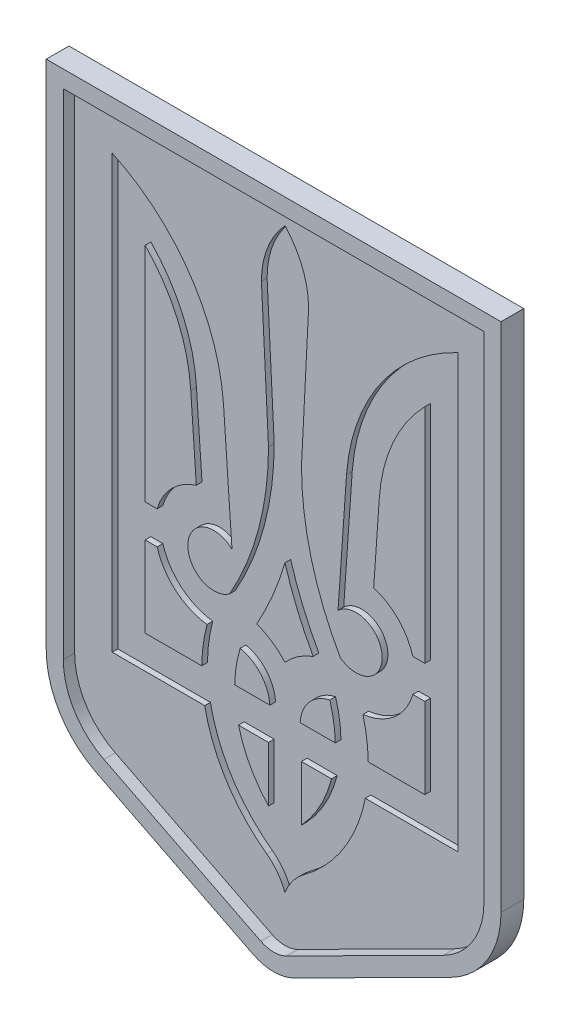
from build123d import *

# Parameters (mm, degrees)
EXTRUDE_1_DEPTH     = 2
EXTRUDE_2_DEPTH     = 2
OTHER_START         = 1
OTHER_1_DEPTH       = 1
CUT_EXTRUDE_1_DEPTH = 10


# Read off the part's stored shape, not the designer's step: Полость1
with BuildPart() as part:
    # Эскиз1 → Бобышка-Вытянуть1 (new body)
    with BuildSketch(Plane.XY):
        with BuildLine():
            Line((-3.59812982, 1.811928513), (-31.19625964, 15.709658955))
            ThreePointArc((-31.19625964, 15.709658955), (-37.622410841, 21.607746257), (-40, 30))
            Line((-40, 30), (-40, 120))
            Line((-40, 120), (40, 120))
            Line((40, 120), (40, 30))
            ThreePointArc((40, 30), (37.622410841, 21.607746257), (31.19625964, 15.709658955))
            Line((31.19625964, 15.709658955), (3.59812982, 1.811928513))
            ThreePointArc((3.59812982, 1.811928513), (0, 0.957099036), (-3.59812982, 1.811928513))
        make_face()
    extrude(amount=EXTRUDE_1_DEPTH)

    # Эскиз2 → Бобышка-Вытянуть2 (add)
    with BuildSketch(Plane.XY.offset(2)):
        with BuildLine():
            Line((40, 120), (-40, 120))
            Line((-40, 120), (-40, 30))
            ThreePointArc((-40, 30), (-37.622410841, 21.607746257), (-31.19625964, 15.709658955))
            Line((-31.19625964, 15.709658955), (-3.59812982, 1.811928513))
            ThreePointArc((-3.59812982, 1.811928513), (0, 0.957099036), (3.59812982, 1.811928513))
            Line((3.59812982, 1.811928513), (31.19625964, 15.709658955))
            ThreePointArc((31.19625964, 15.709658955), (37.622410841, 21.607746257), (40, 30))
            Line((40, 30), (40, 120))
        make_face()
        with BuildLine():
            Line((37, 117), (-37, 117))
            Line((-37, 117), (-37, 30))
            ThreePointArc((-37, 30), (-35.068208808, 23.181293834), (-29.846960958, 18.389097901))
            Line((-29.846960958, 18.389097901), (-2.248831138, 4.491367459))
            ThreePointArc((-2.248831138, 4.491367459), (0, 3.957099036), (2.248831138, 4.491367459))
            Line((2.248831138, 4.491367459), (29.846960958, 18.389097901))
            ThreePointArc((29.846960958, 18.389097901), (35.068208808, 23.181293834), (37, 30))
            Line((37, 30), (37, 117))
        make_face(mode=Mode.SUBTRACT)
    extrude(amount=EXTRUDE_2_DEPTH)

    # Полость1 outline → Полость1 (cut)
    with BuildSketch(Plane.XY.offset(OTHER_START)):
        with BuildLine():
            ThreePointArc((9.788029472, 60.549586915), (17.495233568, 56.130696454), (9.431968209, 52.400905625))
            ThreePointArc((9.431968209, 52.400905625), (4.262579544, 64.984556644), (2.5, 78.473966026))
            Line((2.5, 78.473966026), (3.75, 103.098966026))
            ThreePointArc((3.75, 103.098966026), (2.7812152, 108.402266884), (0, 113.020533442))
            ThreePointArc((0, 113.020533442), (-2.7812152, 108.402266884), (-3.75, 103.098966026))
            Line((-3.75, 103.098966026), (-2.5, 78.473966026))
            ThreePointArc((-2.5, 78.473966026), (-4.262579544, 64.984556644), (-9.431968209, 52.400905625))
            ThreePointArc((-9.431968209, 52.400905625), (-17.495233567, 56.130696454), (-9.788029472, 60.549586915))
            Line((-9.788029472, 60.549586915), (-11.224736233, 81.095450805))
            ThreePointArc((-11.224736233, 81.095450805), (-16.940759264, 97.456053222), (-30, 108.848966026))
            Line((-30, 108.848966026), (-30, 33.848966026))
            Line((-30, 33.848966026), (-13.791634566, 33.848966026))
            ThreePointArc((-13.791634566, 33.848966026), (-10.030008845, 24.210277963), (-2.972883984, 16.643830691))
            ThreePointArc((-2.972883984, 16.643830691), (-1.271172874, 15.008808512), (0, 13.020533442))
            ThreePointArc((0, 13.020533442), (1.271172874, 15.008808512), (2.972883984, 16.643830691))
            ThreePointArc((2.972883984, 16.643830691), (10.030008845, 24.210277963), (13.791634566, 33.848966026))
            Line((13.791634566, 33.848966026), (30, 33.848966026))
            Line((30, 33.848966026), (30, 108.848966026))
            ThreePointArc((30, 108.848966026), (16.940759264, 97.456053222), (11.224736233, 81.095450805))
            Line((11.224736233, 81.095450805), (9.788029472, 60.549586915))
        make_face()
        with BuildLine():
            ThreePointArc((-2.5, 22.780752061), (-6.389541147, 27.869966821), (-8.687410968, 33.848966026))
            Line((-8.687410968, 33.848966026), (-2.5, 33.848966026))
            Line((-2.5, 33.848966026), (-2.5, 22.780752061))
        make_face(mode=Mode.SUBTRACT)
        with BuildLine():
            ThreePointArc((-13.200536483, 46.373533772), (-13.986370475, 42.647666246), (-14.25, 38.848966026))
            Line((-14.25, 38.848966026), (-25, 38.848966026))
            Line((-25, 38.848966026), (-25, 53.848966026))
            Line((-25, 53.848966026), (-22.182458365, 53.848966026))
            ThreePointArc((-22.182458365, 53.848966026), (-18.897043641, 48.662755473), (-13.200536483, 46.373533772))
        make_face(mode=Mode.SUBTRACT)
        with BuildLine():
            ThreePointArc((-8.161111111, 45.763756043), (-3.92918135, 43.397470053), (-2.25, 38.848966026))
            Line((-2.25, 38.848966026), (-9.25, 38.848966026))
            ThreePointArc((-9.25, 38.848966026), (-8.976110771, 42.348966026), (-8.161111111, 45.763756043))
        make_face(mode=Mode.SUBTRACT)
        with BuildLine():
            Line((2.5, 22.780752061), (2.5, 33.848966026))
            Line((2.5, 33.848966026), (8.687410969, 33.848966026))
            ThreePointArc((8.687410969, 33.848966026), (6.389541147, 27.869966821), (2.5, 22.780752061))
        make_face(mode=Mode.SUBTRACT)
        with BuildLine():
            ThreePointArc((2.25, 38.848966026), (3.92918135, 43.397470053), (8.161111111, 45.763756043))
            ThreePointArc((8.161111111, 45.763756043), (8.976110771, 42.348966026), (9.25, 38.848966026))
            Line((9.25, 38.848966026), (2.25, 38.848966026))
        make_face(mode=Mode.SUBTRACT)
        with BuildLine():
            ThreePointArc((0, 63.756825508), (2.33883829, 56.831501462), (5.545675565, 50.262904017))
            ThreePointArc((5.545675565, 50.262904017), (2.504193555, 48.773385172), (0, 46.493408451))
            ThreePointArc((0, 46.493408451), (-2.504193555, 48.773385172), (-5.545675565, 50.262904017))
            ThreePointArc((-5.545675565, 50.262904017), (-2.33883829, 56.831501462), (0, 63.756825508))
        make_face(mode=Mode.SUBTRACT)
        with BuildLine():
            ThreePointArc((14.25, 38.848966026), (13.986370475, 42.647666246), (13.200536483, 46.373533772))
            ThreePointArc((13.200536483, 46.373533772), (18.897043642, 48.662755473), (22.182458366, 53.848966026))
            Line((22.182458366, 53.848966026), (25, 53.848966026))
            Line((25, 53.848966026), (25, 38.848966026))
            Line((25, 38.848966026), (14.25, 38.848966026))
        make_face(mode=Mode.SUBTRACT)
        with BuildLine():
            ThreePointArc((-15.180187421, 65.983103008), (-19.636717055, 63.353769354), (-22.182458365, 58.848966026))
            Line((-22.182458365, 58.848966026), (-25, 58.848966026))
            Line((-25, 58.848966026), (-25, 99.303564565))
            ThreePointArc((-25, 99.303564565), (-18.795712851, 90.606876243), (-16.177801663, 80.249651334))
            Line((-16.177801663, 80.249651334), (-15.180187421, 65.983103008))
        make_face(mode=Mode.SUBTRACT)
        with BuildLine():
            ThreePointArc((16.177801663, 80.249651334), (18.795712851, 90.606876243), (25, 99.303564565))
            Line((25, 99.303564565), (25, 58.848966026))
            Line((25, 58.848966026), (22.182458366, 58.848966026))
            ThreePointArc((22.182458366, 58.848966026), (19.636717055, 63.353769354), (15.180187421, 65.983103008))
            Line((15.180187421, 65.983103008), (16.177801663, 80.249651334))
        make_face(mode=Mode.SUBTRACT)
    extrude(amount=OTHER_1_DEPTH, mode=Mode.SUBTRACT)

    # Эскиз3 → Вырез-Вытянуть1 (cut)
    with BuildSketch(Plane.XY.offset(1)):
        with BuildLine():
            Line((-30.4, 109.485933086), (-30.4, 33.448966026))
            Line((-30.4, 33.448966026), (-14.122431386, 33.448966026))
            ThreePointArc((-14.122431386, 33.448966026), (-10.280405338, 23.857967906), (-3.211502278, 16.322782533))
            ThreePointArc((-3.211502278, 16.322782533), (-1.296555795, 14.391675131), (0, 12.001039461))
            ThreePointArc((0, 12.001039461), (1.296555795, 14.391675131), (3.211502278, 16.322782533))
            ThreePointArc((3.211502278, 16.322782533), (10.280405338, 23.857967906), (14.122431386, 33.448966026))
            Line((14.122431386, 33.448966026), (30.4, 33.448966026))
            Line((30.4, 33.448966026), (30.4, 109.485933086))
            ThreePointArc((30.4, 109.485933086), (16.789759987, 97.944057432), (10.825816986, 81.124874611))
            Line((10.825816986, 81.124874611), (9.326149592, 59.678631713))
            ThreePointArc((9.326149592, 59.678631713), (17.092035273, 56.619543276), (9.739143413, 52.669608621))
            ThreePointArc((9.739143413, 52.669608621), (4.640098892, 65.12142468), (2.900000984, 78.46383966))
            Line((2.900000984, 78.46383966), (4.149996614, 103.088753565))
            ThreePointArc((4.149996614, 103.088753565), (3.076851741, 108.747091307), (0, 113.615500626))
            ThreePointArc((0, 113.615500626), (-3.076851741, 108.747091307), (-4.149996614, 103.088753565))
            Line((-4.149996614, 103.088753565), (-2.900000984, 78.46383966))
            ThreePointArc((-2.900000984, 78.46383966), (-4.640098892, 65.12142468), (-9.739143413, 52.669608621))
            ThreePointArc((-9.739143413, 52.669608621), (-17.092035273, 56.619543276), (-9.326149592, 59.678631713))
            Line((-9.326149592, 59.678631713), (-10.825816986, 81.124874611))
            ThreePointArc((-10.825816986, 81.124874611), (-16.789759986, 97.944057431), (-30.4, 109.485933086))
        make_face()
        with BuildLine():
            Line((-24.6, 98.342803418), (-24.6, 59.248966026))
            Line((-24.6, 59.248966026), (-22.487492178, 59.248966026))
            ThreePointArc((-22.487492178, 59.248966026), (-19.927985451, 63.628047845), (-15.601624133, 66.275693973))
            Line((-15.601624133, 66.275693973), (-16.57694324, 80.223407018))
            ThreePointArc((-16.57694324, 80.223407018), (-18.961550559, 90.003486832), (-24.6, 98.342803418))
        make_face(mode=Mode.SUBTRACT)
        with BuildLine():
            Line((-24.6, 39.248966026), (-14.647132469, 39.248966026))
            ThreePointArc((-14.647132469, 39.248966026), (-14.388051735, 42.663162704), (-13.71270618, 46.019912646))
            ThreePointArc((-13.71270618, 46.019912646), (-19.220031201, 48.411637718), (-22.487492178, 53.448966026))
            Line((-22.487492178, 53.448966026), (-24.6, 53.448966026))
            Line((-24.6, 53.448966026), (-24.6, 39.248966026))
        make_face(mode=Mode.SUBTRACT)
        with BuildLine():
            Line((-8.846379794, 39.248966026), (-2.662132363, 39.248966026))
            ThreePointArc((-2.662132363, 39.248966026), (-4.251709751, 43.159081405), (-7.885555556, 45.306387443))
            ThreePointArc((-7.885555556, 45.306387443), (-8.577119532, 42.311169504), (-8.846379794, 39.248966026))
        make_face(mode=Mode.SUBTRACT)
        with BuildLine():
            Line((2.662132363, 39.248966026), (8.846379794, 39.248966026))
            ThreePointArc((8.846379794, 39.248966026), (8.577119532, 42.311169504), (7.885555556, 45.306387443))
            ThreePointArc((7.885555556, 45.306387443), (4.251709751, 43.159081405), (2.662132363, 39.248966026))
        make_face(mode=Mode.SUBTRACT)
        with BuildLine():
            Line((-2.9, 33.448966026), (-8.180118992, 33.448966026))
            ThreePointArc((-8.180118992, 33.448966026), (-6.154149081, 28.271206412), (-2.9, 23.762962579))
            Line((-2.9, 23.762962579), (-2.9, 33.448966026))
        make_face(mode=Mode.SUBTRACT)
        with BuildLine():
            Line((8.180118992, 33.448966026), (2.9, 33.448966026))
            Line((2.9, 33.448966026), (2.9, 23.762962579))
            ThreePointArc((2.9, 23.762962579), (6.154149081, 28.271206412), (8.180118992, 33.448966026))
        make_face(mode=Mode.SUBTRACT)
        with BuildLine():
            Line((14.647132469, 39.248966026), (24.6, 39.248966026))
            Line((24.6, 39.248966026), (24.6, 53.448966026))
            Line((24.6, 53.448966026), (22.487492178, 53.448966026))
            ThreePointArc((22.487492178, 53.448966026), (19.220031201, 48.411637718), (13.71270618, 46.019912646))
            ThreePointArc((13.71270618, 46.019912646), (14.388051735, 42.663162704), (14.647132469, 39.248966026))
        make_face(mode=Mode.SUBTRACT)
        with BuildLine():
            Line((22.487492178, 59.248966026), (24.6, 59.248966026))
            Line((24.6, 59.248966026), (24.6, 98.342803418))
            ThreePointArc((24.6, 98.342803418), (18.961550559, 90.003486832), (16.57694324, 80.223407018))
            Line((16.57694324, 80.223407018), (15.601624133, 66.275693973))
            ThreePointArc((15.601624133, 66.275693973), (19.927985451, 63.628047845), (22.487492178, 59.248966026))
        make_face(mode=Mode.SUBTRACT)
        with BuildLine():
            ThreePointArc((0, 47.107143791), (-2.273385478, 49.100153753), (-4.961500663, 50.483774724))
            ThreePointArc((-4.961500663, 50.483774724), (-2.150697128, 56.242155237), (0, 62.278218899))
            ThreePointArc((0, 62.278218899), (2.150697128, 56.242155237), (4.961500663, 50.483774724))
            ThreePointArc((4.961500663, 50.483774724), (2.273385478, 49.100153753), (0, 47.107143791))
        make_face(mode=Mode.SUBTRACT)
    extrude(amount=CUT_EXTRUDE_1_DEPTH, mode=Mode.SUBTRACT)


solid = part.part
